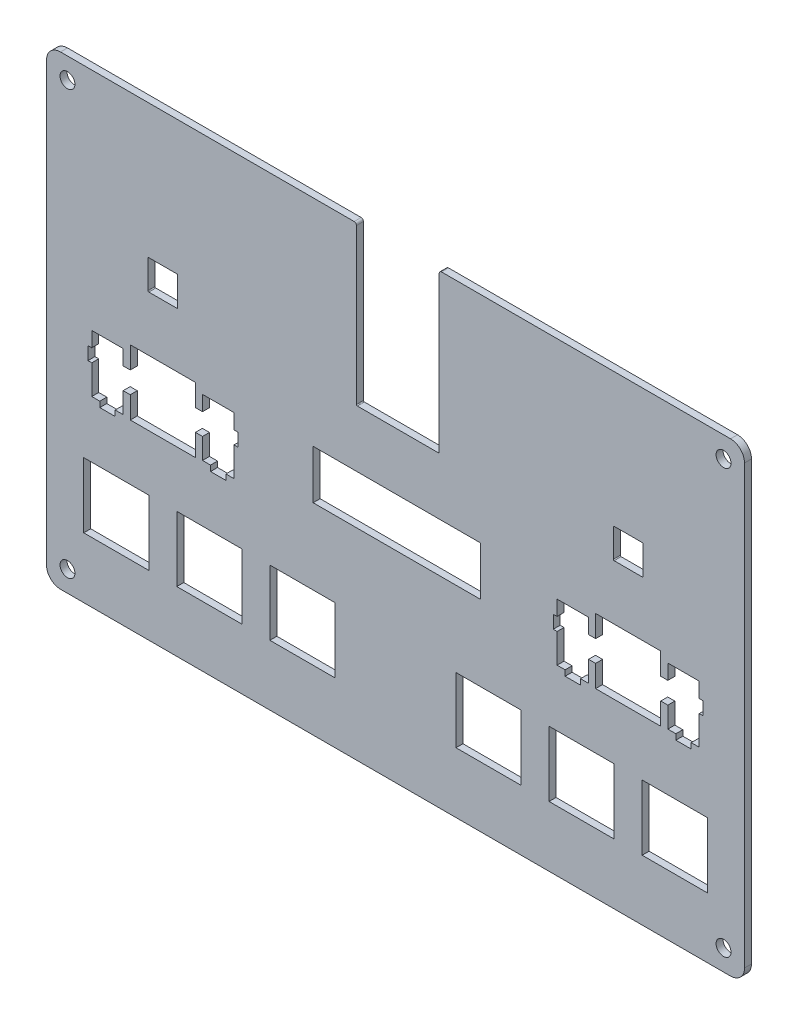
from build123d import *

# Parameters (mm, degrees)
MODEL_R         = 1.6
MODEL_W         = 14.0000128
MODEL_H         = 14.0000128
MODEL_W_2       = 36
MODEL_H_2       = 10.5
EXTRUDE_1_DEPTH = 1.5


with BuildPart() as part:
    # Model → 凸台-拉伸1 (new body)
    with BuildSketch(Plane.XY):
        with BuildLine():
            ThreePointArc((0, 2.99999654), (0.878679387, 0.878681927), (2.999994, 2.54e-06))
            Line((2.999994, 2.54e-06), (147.0000108, 2.54e-06))
            ThreePointArc((147.0000108, 2.54e-06), (149.121322873, 0.878681927), (150.00000226, 2.999994))
            Line((150.00000226, 2.999994), (150.00000226, 97.0000092))
            ThreePointArc((150.00000226, 97.0000092), (149.121318821, 99.121324665), (147, 100))
            Line((147, 100), (84.889976, 100))
            ThreePointArc((84.889976, 100), (84.536422609, 99.853553391), (84.389976, 99.5))
            Line((84.389976, 99.5), (84.389976, 66.2))
            ThreePointArc((84.389976, 66.2), (84.331397356, 66.058578644), (84.189976, 66))
            Line((84.189976, 66), (66.809976, 66))
            ThreePointArc((66.809976, 66), (66.668554644, 66.058578644), (66.609976, 66.2))
            Line((66.609976, 66.2), (66.609976, 99.5))
            ThreePointArc((66.609976, 99.5), (66.463529391, 99.853553391), (66.109976, 100))
            Line((66.109976, 100), (3, 100))
            ThreePointArc((3, 100), (0.878683538, 99.121324764), (0, 97.00001174))
            Line((0, 97.00001174), (0, 2.99999654))
        make_face()
        with Locations((4.49999354, 4.49999608)):
            Circle(MODEL_R, mode=Mode.SUBTRACT)
        with Locations((15.0000208, 20.00001842)):
            Rectangle(MODEL_W, MODEL_H, mode=Mode.SUBTRACT)
        with Locations((35.0000208, 20.00001842)):
            Rectangle(MODEL_W, MODEL_H, mode=Mode.SUBTRACT)
        with Locations((55.0000208, 20.00001842)):
            Rectangle(MODEL_W, MODEL_H, mode=Mode.SUBTRACT)
        Polygon((17.99997, 48.299), (17.99997, 52.9994), (31.99947, 52.9994), (31.99947, 48.299), (33.52497, 48.299), (33.52497, 51.5292), (40.27447, 51.5292), (40.27447, 48.299), (41.09997, 48.299), (41.09997, 45.5002), (40.27447, 45.5002), (40.27447, 39.2302), (38.54927, 39.2302), (38.54927, 38.0299), (35.24887, 38.0299), (35.24887, 39.2302), (33.52497, 39.2302), (33.52497, 43.6991), (31.99947, 43.6991), (31.99947, 39), (17.99997, 39), (17.99997, 43.6991), (16.47447, 43.6991), (16.47447, 39.2302), (14.74918, 39.2302), (14.74918, 38.0299), (11.45016, 38.0299), (11.45016, 39.2302), (9.72487, 39.2302), (9.72487, 45.5002), (8.8994, 45.5002), (8.8994, 48.299), (9.72487, 48.299), (9.72487, 51.5292), (16.47447, 51.5292), (16.47447, 48.299), align=None, mode=Mode.SUBTRACT)
        with Locations((95.0000132, 20.00001842)):
            Rectangle(MODEL_W, MODEL_H, mode=Mode.SUBTRACT)
        with Locations((145.5000138, 4.49999608)):
            Circle(MODEL_R, mode=Mode.SUBTRACT)
        with Locations((115.0000132, 20.00001842)):
            Rectangle(MODEL_W, MODEL_H, mode=Mode.SUBTRACT)
        with Locations((135.0000132, 20.00001842)):
            Rectangle(MODEL_W, MODEL_H, mode=Mode.SUBTRACT)
        with Locations((75.3, 48.5)):
            Rectangle(MODEL_W_2, MODEL_H_2, mode=Mode.SUBTRACT)
        Polygon((117.99997, 48.299), (117.99997, 52.9994), (131.99947, 52.9994), (131.99947, 48.299), (133.52497, 48.299), (133.52497, 51.5292), (140.27447, 51.5292), (140.27447, 48.299), (141.09997, 48.299), (141.09997, 45.5002), (140.27447, 45.5002), (140.27447, 39.2302), (138.54927, 39.2302), (138.54927, 38.0299), (135.24887, 38.0299), (135.24887, 39.2302), (133.52497, 39.2302), (133.52497, 43.6991), (131.99947, 43.6991), (131.99947, 39), (117.99997, 39), (117.99997, 43.6991), (116.47447, 43.6991), (116.47447, 39.2302), (114.74918, 39.2302), (114.74918, 38.0299), (111.45016, 38.0299), (111.45016, 39.2302), (109.72487, 39.2302), (109.72487, 45.5002), (108.8994, 45.5002), (108.8994, 48.299), (109.72487, 48.299), (109.72487, 51.5292), (116.47447, 51.5292), (116.47447, 48.299), align=None, mode=Mode.SUBTRACT)
        with BuildLine():
            Line((28.001273066, 64.80000027), (25.001314277, 64.80000027))
            Line((25.001314277, 64.80000027), (24.998685723, 64.80000027))
            Line((24.998685723, 64.80000027), (22.00127321, 64.80000027))
            ThreePointArc((22.00127321, 64.80000027), (21.859866375, 64.858564394), (21.801273214, 64.999959199))
            Line((21.801273214, 64.999959199), (21.80004108, 70.999958929))
            ThreePointArc((21.80004108, 70.999958929), (21.858605199, 71.141406835), (22.000041075, 71.2))
            Line((22.000041075, 71.2), (28.000040932, 71.2))
            ThreePointArc((28.000040932, 71.2), (28.141447767, 71.141435876), (28.200040928, 71.000041071))
            Line((28.200040928, 71.000041071), (28.201273062, 65.000041341))
            ThreePointArc((28.201273062, 65.000041341), (28.142708943, 64.858593435), (28.001273066, 64.80000027))
        make_face(mode=Mode.SUBTRACT)
        with Locations((4.49999862, 95.50000204)):
            Circle(MODEL_R, mode=Mode.SUBTRACT)
        with BuildLine():
            Line((122.000041075, 71.2), (128.000040932, 71.2))
            ThreePointArc((128.000040932, 71.2), (128.141447767, 71.141435876), (128.200040928, 71.000041071))
            Line((128.200040928, 71.000041071), (128.201273062, 65.000041341))
            ThreePointArc((128.201273062, 65.000041341), (128.142708943, 64.858593435), (128.001273066, 64.80000027))
            Line((128.001273066, 64.80000027), (122.00127321, 64.80000027))
            ThreePointArc((122.00127321, 64.80000027), (121.859866375, 64.858564394), (121.801273214, 64.999959199))
            Line((121.801273214, 64.999959199), (121.80004108, 70.999958929))
            ThreePointArc((121.80004108, 70.999958929), (121.858605199, 71.141406835), (122.000041075, 71.2))
        make_face(mode=Mode.SUBTRACT)
        with Locations((145.5000138, 95.50001474)):
            Circle(MODEL_R, mode=Mode.SUBTRACT)
    extrude(amount=EXTRUDE_1_DEPTH)


solid = part.part
